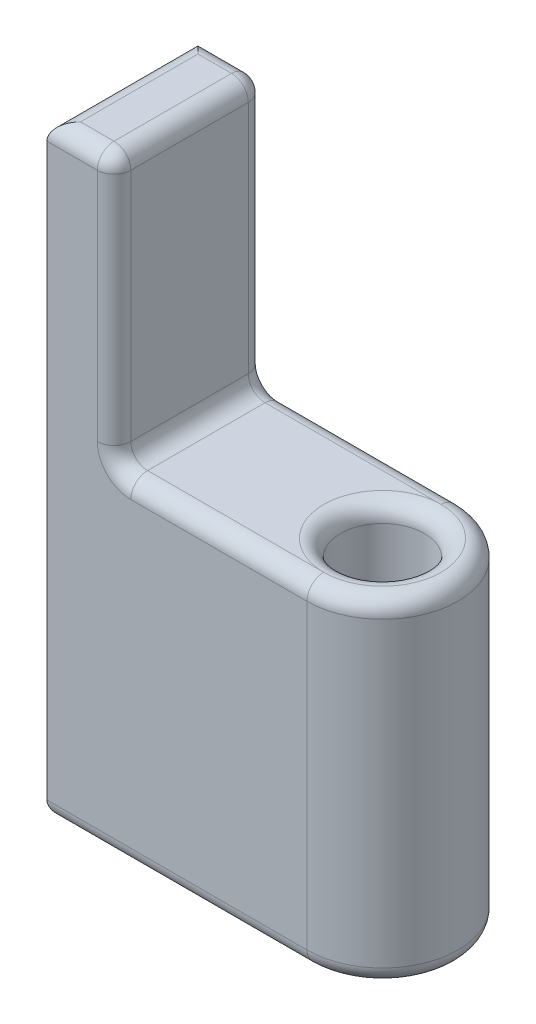
from build123d import *

# Parameters (mm, degrees)
SKETCH1_R           = 2.5
BOSS_EXTRUDE1_DEPTH = 20
SKETCH2_W           = 4
SKETCH2_H           = 9
BOSS_EXTRUDE2_DEPTH = 16
FILLET1_R           = 1


with BuildPart() as part:
    # Sketch1 → Boss-Extrude1 (new body)
    with BuildSketch(Plane(origin=(0, 0, 0), x_dir=(1, 0, 0), z_dir=(0, 1, 0))):
        with BuildLine():
            Line((0, 0), (15.5, 0))
            ThreePointArc((15.5, 0), (20, 4.5), (15.5, 9))
            Line((15.5, 9), (0, 9))
            Line((0, 9), (0, 0))
        make_face()
        with Locations(Location((15.5, 4.5, 0), (0, 0, 270))):
            Circle(SKETCH1_R, mode=Mode.SUBTRACT)
    extrude(amount=BOSS_EXTRUDE1_DEPTH)

    # Sketch2 → Boss-Extrude2 (add)
    with BuildSketch(Plane(origin=(0, 20, 0), x_dir=(1, 0, 0), z_dir=(0, 1, 0))):
        with Locations((2, 4.5)):
            Rectangle(SKETCH2_W, SKETCH2_H)
    extrude(amount=BOSS_EXTRUDE2_DEPTH)

    # Fillet1
    fillet1_edges = [part.edges().sort_by_distance(p)[0] for p in [
        (15.5, 0, -7),
        (15.5, 20, -7),
        (20, 20, -4.5),
        (9.75, 20, -9),
        (9.75, 20, 0),
        (4, 20, -4.5),
        (4, 28, 0),
        (4, 28, -9),
        (0, 36, -4.5),
        (2, 36, 0),
        (4, 36, -4.5),
        (2, 36, -9),
        (7.75, 0, -9),
        (20, 0, -4.5),
        (7.75, 0, 0),
        (0, 0, -4.5),
    ]]
    fillet(fillet1_edges, radius=FILLET1_R - 0.0001)  # a hair under: the kernel refuses the full size


solid = part.part
